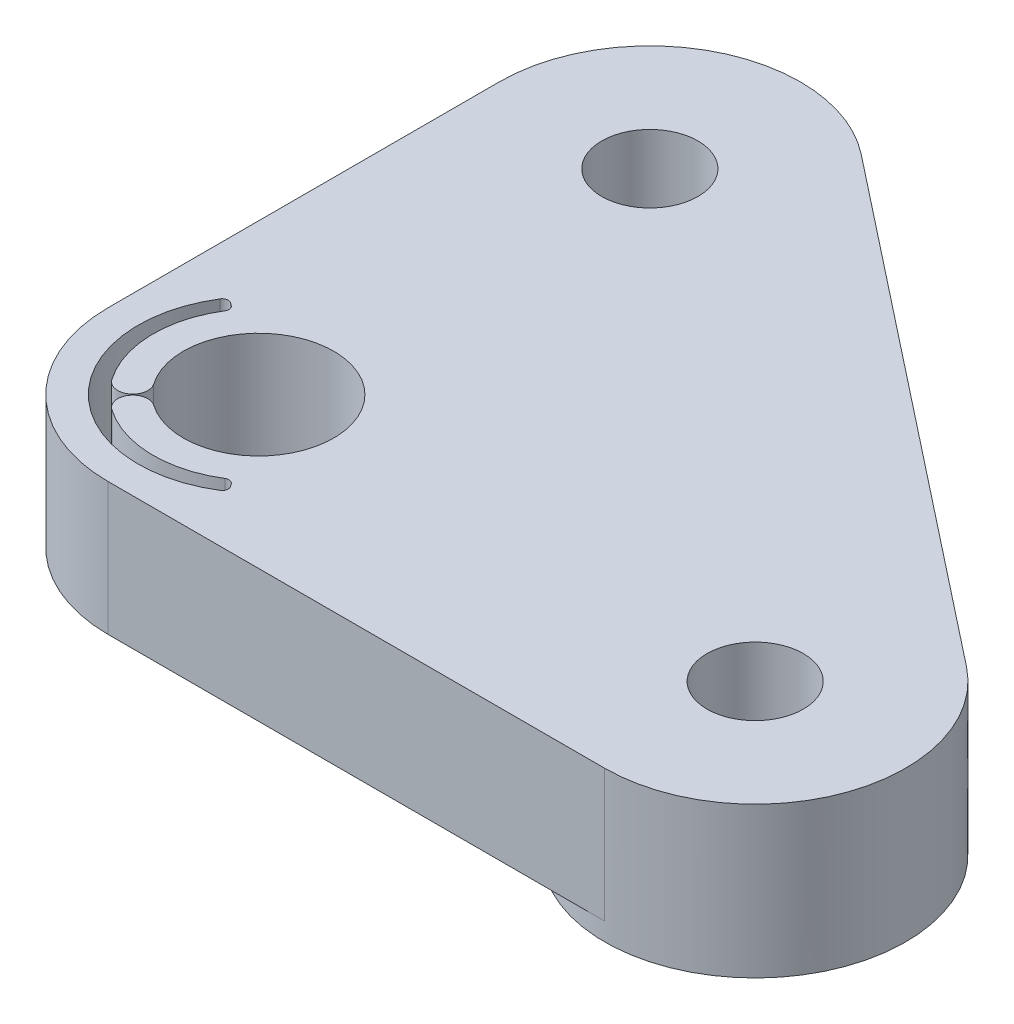
from build123d import *
from build123d.topology import SkipClean

# Parameters (mm, degrees)
SKETCH1_R           = 1.6
SKETCH1_R_2         = 2.5
BOSS_EXTRUDE1_DEPTH = 1.57
FILLET1_R           = 5
SKETCH2_R           = 2.5
SKETCH2_R_2         = 1.6
BOSS_EXTRUDE2_DEPTH = 2.83
SKETCH3_R           = 5
SKETCH3_R_2         = 1.6
BOSS_EXTRUDE3_DEPTH = 0.6
CUT_EXTRUDE1_START  = -10
CUT_EXTRUDE1_DEPTH  = 10
SKETCH5_W           = 1.221153846
SKETCH5_H           = 0.325641026
PART_NUM_LEFT_DEPTH = 0.4


with BuildPart() as part:
    # Sketch1 → Boss-Extrude1 (new body)
    with BuildSketch(Plane(origin=(0, 0, 0), x_dir=(1, 0, 0), z_dir=(0, 1, 0))):
        Polygon((-5, -5), (30.925365976, -5), (-5, 23.304833799), align=None)
        with Locations((16.5, 0)):
            Circle(SKETCH1_R, mode=Mode.SUBTRACT)
        Circle(SKETCH1_R_2, mode=Mode.SUBTRACT)
        with Locations((0, 13)):
            Circle(SKETCH1_R, mode=Mode.SUBTRACT)
    extrude(amount=BOSS_EXTRUDE1_DEPTH)

    # Fillet1
    fillet1_edges = [part.edges().sort_by_distance(p)[0] for p in [
        (-5, 0.785, -23.304833799),
        (-5, 0.785, 5),
        (30.925365976, 0.785, 5),
    ]]
    fillet(fillet1_edges, radius=FILLET1_R)

    # Sketch2 → Boss-Extrude2 (add)
    with BuildSketch(Plane(origin=(0, 1.57, 0), x_dir=(1, 0, 0), z_dir=(0, 1, 0))):
        with BuildLine():
            Line((19.594361133, 3.927458361), (3.094361133, 16.927458361))
            ThreePointArc((3.094361133, 16.927458361), (-2.182681188, 17.498433375), (-5, 13))
            Line((-5, 13), (-5, 0))
            ThreePointArc((-5, 0), (-3.535533906, -3.535533906), (0, -5))
            Line((0, -5), (16.5, -5))
            ThreePointArc((16.5, -5), (21.224261413, -1.637484075), (19.594361133, 3.927458361))
        make_face()
        Circle(SKETCH2_R, mode=Mode.SUBTRACT)
        with Locations((16.5, 0)):
            Circle(SKETCH2_R_2, mode=Mode.SUBTRACT)
        with Locations((0, 13)):
            Circle(SKETCH2_R_2, mode=Mode.SUBTRACT)
    extrude(amount=BOSS_EXTRUDE2_DEPTH)

    # Sketch3 → Boss-Extrude3 (add)
    # profile 1 of 2: a face of its own
    with SkipClean():  # the faces are left unmerged after this step: merging them gives an invalid solid
        with BuildSketch(Plane.XZ):
            with Locations((16.5, 0)):
                Circle(SKETCH3_R)
            with Locations((16.5, 0)):
                Circle(SKETCH3_R_2, mode=Mode.SUBTRACT)
        # profile 2 of 2: a face of its own
        with BuildSketch(Plane.XZ):
            with Locations((0, -13)):
                Circle(SKETCH3_R)
            with Locations((0, -13)):
                Circle(SKETCH3_R_2, mode=Mode.SUBTRACT)
        extrude(amount=BOSS_EXTRUDE3_DEPTH)
    add(part.part.scale(1), mode=Mode.REPLACE)  # the faces are merged on a copy

    # Sketch4 → Cut-Extrude1 (cut)
    with BuildSketch(Plane(origin=(0, 4.4, 0), x_dir=(1, 0, 0), z_dir=(0, 1, 0)).offset(CUT_EXTRUDE1_START)):
        with BuildLine():
            Line((2.119130133, -3.026431476), (2.176569541, -3.108463452))
            ThreePointArc((2.176569541, -3.108463452), (2.208718169, -3.263081334), (2.118672771, -3.392819725))
            ThreePointArc((2.118672771, -3.392819725), (-2.828427125, -2.828427125), (-3.392819725, 2.118672771))
            ThreePointArc((-3.392819725, 2.118672771), (-3.263081334, 2.208718169), (-3.108463452, 2.176569541))
            Line((-3.108463452, 2.176569541), (-3.026431476, 2.119130133))
            ThreePointArc((-3.026431476, 2.119130133), (-2.945196197, 1.995341896), (-2.971355046, 1.849607847))
            ThreePointArc((-2.971355046, 1.849607847), (-3.498720526, -0.094629188), (-2.867032155, -2.007517527))
            ThreePointArc((-2.867032155, -2.007517527), (-2.170667915, -2.130305331), (-2.047880111, -1.433941091))
            ThreePointArc((-2.047880111, -1.433941091), (-1.767766953, -1.767766953), (-1.433941091, -2.047880111))
            ThreePointArc((-1.433941091, -2.047880111), (-2.130305331, -2.170667915), (-2.007517527, -2.867032155))
            ThreePointArc((-2.007517527, -2.867032155), (-0.094629188, -3.498720526), (1.849607847, -2.971355046))
            ThreePointArc((1.849607847, -2.971355046), (1.995341896, -2.945196197), (2.119130133, -3.026431476))
        make_face()
    extrude(amount=CUT_EXTRUDE1_DEPTH, mode=Mode.SUBTRACT)

    # Sketch5 → Part Num Left (cut)
    # profile 1 of 6: a face of its own
    with BuildSketch(Plane(origin=(9.413907875, 0, -11.948421534), x_dir=(-0.7854916722275357, 0, -0.6188722266035127), z_dir=(0.6188722266035127, 0, -0.7854916722275357))):
        Polygon((-9.377508618, 3.775), (-9.09257272, 3.775), (-9.09257272, 0.925641026), (-7.871418874, 0.925641026), (-7.871418874, 0.6), (-9.377508618, 0.6), align=None)
    # profile 2 of 6: a face of its own
    with BuildSketch(Plane(origin=(9.413907875, 0, -11.948421534), x_dir=(-0.7854916722275357, 0, -0.6188722266035127), z_dir=(0.6188722266035127, 0, -0.7854916722275357))):
        with BuildLine():
            Line((-4.411482977, 3.192407853), (-4.660801887, 3.001602564))
            add(Edge.make_bspline(
                [(-4.660801887, 3.001602564), (-4.678587229, 3.022798837), (-4.713918127, 3.06490561), (-4.770758975, 3.124032768), (-4.829996894, 3.179427684), (-4.891609239, 3.231354246), (-4.956705012, 3.277996598), (-5.023707308, 3.321785384), (-5.093736963, 3.361035404), (-5.190576037, 3.408626827), (-5.317256585, 3.45828941), (-5.476727618, 3.499930199), (-5.6431984, 3.52643798), (-5.756770508, 3.529308943), (-5.814537865, 3.530769231)],
                knots=[0, 0, 0, 0, 0.757959112, 1.505699292, 2.245454638, 2.979532153, 3.711538275, 4.438200793, 5.171680507, 5.909471876, 7.393775596, 8.890124382, 10.418191784, 12, 12, 12, 12], degree=3))
            add(Edge.make_bspline(
                [(-5.814537865, 3.530769231), (-5.846363429, 3.530402779), (-5.909719187, 3.529673277), (-6.003743159, 3.520049285), (-6.096011427, 3.506522687), (-6.186463971, 3.486451858), (-6.274985655, 3.461076696), (-6.362155191, 3.430755071), (-6.446710521, 3.393240323), (-6.529821351, 3.351776402), (-6.609449636, 3.304942934), (-6.684792429, 3.253858679), (-6.755574943, 3.199095284), (-6.821853169, 3.140447495), (-6.883694865, 3.078179431), (-6.940651926, 3.011627492), (-6.992527262, 2.941004449), (-7.040349135, 2.867241573), (-7.083177829, 2.790553719), (-7.119037077, 2.710657048), (-7.150791723, 2.628919754), (-7.175918893, 2.544418344), (-7.195807562, 2.457747406), (-7.209530514, 2.368674334), (-7.219045056, 2.277385211), (-7.21977093, 2.21550962), (-7.220136823, 2.184319912)],
                knots=[0, 0, 0, 0, 1.054917814, 2.100044995, 3.131103042, 4.146048494, 5.169673617, 6.183595914, 7.203665975, 8.234915748, 9.262203917, 10.264457458, 11.251630812, 12.227803204, 13.197192746, 14.159520551, 15.12972552, 16.100847026, 17.073214652, 18.039054194, 19.002613845, 19.979014051, 20.95965708, 21.949030935, 22.966165397, 24, 24, 24, 24], degree=3))
            add(Edge.make_bspline(
                [(-7.220136823, 2.184319912), (-7.218992173, 2.137392215), (-7.216744804, 2.045255905), (-7.196743815, 1.910299709), (-7.166349911, 1.781013097), (-7.120797209, 1.658204241), (-7.064627785, 1.540358801), (-6.993652373, 1.429470699), (-6.911450228, 1.323864244), (-6.816858434, 1.226035284), (-6.713076015, 1.136669262), (-6.601726123, 1.057974091), (-6.483086091, 0.992374162), (-6.358465862, 0.937785982), (-6.226906459, 0.895824522), (-6.08864446, 0.86628421), (-5.943980578, 0.847014518), (-5.845129765, 0.845169672), (-5.794821318, 0.844230769)],
                knots=[0, 0, 0, 0, 1.029171465, 2.020641659, 2.987623507, 3.938342917, 4.889210282, 5.84687017, 6.821220943, 7.821438502, 8.827599549, 9.822697543, 10.807740252, 11.797342354, 12.80366471, 13.83203677, 14.896651826, 16, 16, 16, 16], degree=3))
            add(Edge.make_bspline(
                [(-5.794821318, 0.844230769), (-5.73939245, 0.845762734), (-5.630295179, 0.848778006), (-5.470304183, 0.874322468), (-5.317146024, 0.915740722), (-5.170812464, 0.973705266), (-5.031716035, 1.049057348), (-4.899639064, 1.140404709), (-4.774470068, 1.248616268), (-4.699203262, 1.331241677), (-4.660801887, 1.373397436)],
                knots=[0, 0, 0, 0, 1.028121516, 2.023589091, 2.998037872, 3.967518031, 4.937445131, 5.927275754, 6.942489185, 8, 8, 8, 8], degree=3))
            Line((-4.660801887, 1.373397436), (-4.411482977, 1.1845002))
            add(Edge.make_bspline(
                [(-4.411482977, 1.1845002), (-4.431547262, 1.158611748), (-4.471579726, 1.106958846), (-4.536402356, 1.034140938), (-4.604689619, 0.965647992), (-4.676948727, 0.902032221), (-4.752348438, 0.84202067), (-4.832242607, 0.787318294), (-4.915580944, 0.737161564), (-5.002081078, 0.691235711), (-5.091651105, 0.650489351), (-5.1841837, 0.61560629), (-5.279280008, 0.585557283), (-5.376944376, 0.560835883), (-5.477379384, 0.541539972), (-5.5802226, 0.528640695), (-5.685695987, 0.519803387), (-5.756853561, 0.518997921), (-5.792913265, 0.518589744)],
                knots=[0, 0, 0, 0, 0.986787822, 1.968848986, 2.935600012, 3.899624008, 4.868462664, 5.837806735, 6.815139263, 7.798259679, 8.787526145, 9.778297419, 10.776456485, 11.791383307, 12.812564526, 13.85620153, 14.913611965, 16, 16, 16, 16], degree=3))
            add(Edge.make_bspline(
                [(-5.792913265, 0.518589744), (-5.827061449, 0.518827408), (-5.894585254, 0.519297361), (-5.994279121, 0.526910255), (-6.091333955, 0.537296803), (-6.185472366, 0.552936064), (-6.277208072, 0.571391287), (-6.365709459, 0.596130213), (-6.4518474, 0.623842671), (-6.535275823, 0.656413623), (-6.616065694, 0.693167589), (-6.693956437, 0.734707074), (-6.768912229, 0.780682766), (-6.841670004, 0.83008124), (-6.911154955, 0.884489221), (-6.977969224, 0.943151096), (-7.04248747, 1.005869149), (-7.082404192, 1.051094623), (-7.102473562, 1.073833133)],
                knots=[0, 0, 0, 0, 1.114604814, 2.203992996, 3.262667896, 4.300477797, 5.318619304, 6.316056647, 7.298880507, 8.271930387, 9.238335007, 10.195173496, 11.151986948, 12.108099108, 13.064862484, 14.031167946, 15.010108607, 16, 16, 16, 16], degree=3))
            add(Edge.make_bspline(
                [(-7.102473562, 1.073833133), (-7.134618753, 1.113331212), (-7.198521049, 1.191850513), (-7.28027792, 1.319109939), (-7.350261773, 1.451977528), (-7.406845644, 1.591151321), (-7.451080409, 1.736319022), (-7.481724779, 1.88755381), (-7.50163802, 2.044714444), (-7.503915211, 2.151609245), (-7.50507272, 2.205944511)],
                knots=[0, 0, 0, 0, 0.994628077, 1.977248131, 2.950237994, 3.925870899, 4.908910175, 5.911660606, 6.938484602, 8, 8, 8, 8], degree=3))
            add(Edge.make_bspline(
                [(-7.50507272, 2.205944511), (-7.503661938, 2.263054101), (-7.500886311, 2.375413654), (-7.477304411, 2.540308598), (-7.439368788, 2.698288795), (-7.385487325, 2.849059335), (-7.317174614, 2.993413232), (-7.232786185, 3.130247753), (-7.133302421, 3.260437993), (-7.019503556, 3.382008518), (-6.89471033, 3.493169216), (-6.76107112, 3.590964844), (-6.618847497, 3.672351447), (-6.469606303, 3.74038368), (-6.312230006, 3.792675443), (-6.147054378, 3.829281549), (-5.974389791, 3.852066361), (-5.856586019, 3.854946728), (-5.796729371, 3.856410256)],
                knots=[0, 0, 0, 0, 1.032925535, 2.032216505, 3.007276963, 3.968222605, 4.92396291, 5.891752235, 6.871517503, 7.883894988, 8.900124299, 9.891468569, 10.874487609, 11.85992873, 12.854644235, 13.869047385, 14.917252991, 16, 16, 16, 16], degree=3))
            add(Edge.make_bspline(
                [(-5.796729371, 3.856410256), (-5.7602491, 3.855972888), (-5.688040078, 3.855107162), (-5.5812216, 3.846665162), (-5.477224632, 3.832592104), (-5.375977527, 3.813436813), (-5.276987725, 3.789663028), (-5.181011792, 3.7586929), (-5.087486555, 3.72328119), (-4.99700186, 3.682497439), (-4.909991846, 3.636716895), (-4.826483614, 3.586447007), (-4.747140493, 3.531750098), (-4.67140418, 3.47309136), (-4.600541617, 3.40922981), (-4.532540847, 3.341921991), (-4.469711155, 3.269229165), (-4.4309279, 3.218061832), (-4.411482977, 3.192407853)],
                knots=[0, 0, 0, 0, 1.096760587, 2.17092713, 3.219439832, 4.250915756, 5.268269357, 6.278326846, 7.281116186, 8.274029601, 9.260640565, 10.235837813, 11.203064059, 12.156899882, 13.114053108, 14.069676657, 15.032185724, 16, 16, 16, 16], degree=3))
        make_face()
    # profile 3 of 6: a face of its own
    with BuildSketch(Plane(origin=(9.413907875, 0, -11.948421534), x_dir=(-0.7854916722275357, 0, -0.6188722266035127), z_dir=(0.6188722266035127, 0, -0.7854916722275357))):
        with BuildLine():
            Line((-3.760200926, 3.775), (-3.124819315, 3.775))
            add(Edge.make_bspline(
                [(-3.124819315, 3.775), (-3.082418434, 3.774858861), (-3.001004046, 3.774587859), (-2.884369722, 3.773076774), (-2.778390856, 3.768745752), (-2.683122858, 3.76501868), (-2.598567479, 3.758222418), (-2.524465436, 3.751726689), (-2.461158025, 3.743223439), (-2.422835003, 3.735326377), (-2.405483377, 3.731750801)],
                knots=[0, 0, 0, 0, 1.410062039, 2.707475311, 3.878576406, 4.937260626, 5.877586885, 6.699081471, 7.410979367, 8, 8, 8, 8], degree=3))
            add(Edge.make_bspline(
                [(-2.405483377, 3.731750801), (-2.382254511, 3.726011521), (-2.336292314, 3.714655396), (-2.270116182, 3.690652758), (-2.20705676, 3.662876384), (-2.147375991, 3.630252152), (-2.091372809, 3.592537888), (-2.03846977, 3.550384662), (-1.988426814, 3.504023126), (-1.943267763, 3.452284377), (-1.900687338, 3.398004114), (-1.864774798, 3.339308563), (-1.833817206, 3.277929892), (-1.809169665, 3.213243877), (-1.789323218, 3.145877841), (-1.775329415, 3.075221576), (-1.766937266, 3.001596977), (-1.766082869, 2.951379445), (-1.765649643, 2.925916466)],
                knots=[0, 0, 0, 0, 1.027469482, 2.033020251, 3.019912614, 3.986113645, 4.951240523, 5.91722682, 6.890402269, 7.87763091, 8.8651537, 9.85103654, 10.82876324, 11.815024772, 12.821070561, 13.842952187, 14.906261191, 16, 16, 16, 16], degree=3))
            add(Edge.make_bspline(
                [(-1.765649643, 2.925916466), (-1.766982235, 2.883611764), (-1.769582465, 2.801064333), (-1.793825952, 2.681266248), (-1.833537509, 2.569515941), (-1.88825935, 2.46595412), (-1.957945589, 2.372599463), (-2.041697363, 2.290602407), (-2.139561397, 2.221986201), (-2.230665133, 2.174404013), (-2.311141586, 2.143930446), (-2.377393234, 2.122488892), (-2.449662563, 2.105922681), (-2.527257146, 2.091081704), (-2.61049989, 2.079876953), (-2.699191283, 2.071670399), (-2.793394578, 2.066541369), (-2.858109305, 2.065777551), (-2.891400845, 2.065384615)],
                knots=[0, 0, 0, 0, 1.260483769, 2.459530307, 3.627416485, 4.787058657, 5.939039949, 7.08810263, 8.267026773, 9.491475466, 10.141966685, 10.831826277, 11.566392101, 12.351337768, 13.187381173, 14.07005841, 15.007169909, 16, 16, 16, 16], degree=3))
            Line((-2.891400845, 2.065384615), (-1.724944515, 0.6))
            Line((-1.724944515, 0.6), (-2.077298281, 0.6))
            Line((-2.077298281, 0.6), (-3.243754611, 2.065384615))
            Line((-3.243754611, 2.065384615), (-3.475265028, 2.065384615))
            Line((-3.475265028, 2.065384615), (-3.475265028, 0.6))
            Line((-3.475265028, 0.6), (-3.760200926, 0.6))
            Line((-3.760200926, 0.6), (-3.760200926, 3.775))
        make_face()
        with BuildLine():
            Line((-3.475265028, 3.449358974), (-3.475265028, 2.391025641))
            Line((-3.475265028, 2.391025641), (-2.893944916, 2.386573518))
            add(Edge.make_bspline(
                [(-2.893944916, 2.386573518), (-2.866803166, 2.38656151), (-2.814194725, 2.386538236), (-2.738084836, 2.390161162), (-2.667218735, 2.3942826), (-2.601867481, 2.40058665), (-2.542001881, 2.408711086), (-2.487651856, 2.418873793), (-2.438728688, 2.430713879), (-2.381670728, 2.449039639), (-2.31795616, 2.47807367), (-2.248712621, 2.520315229), (-2.189746215, 2.573445788), (-2.139927868, 2.63420028), (-2.09989617, 2.700998877), (-2.071673092, 2.773040869), (-2.053763876, 2.848507533), (-2.051651553, 2.900376245), (-2.050585541, 2.926552484)],
                knots=[0, 0, 0, 0, 1.146690395, 2.22261258, 3.21895312, 4.145990853, 4.996080663, 5.770904154, 6.481378293, 7.121626537, 8.300444488, 9.431385265, 10.535395872, 11.636531494, 12.74115979, 13.810798291, 14.895190096, 16, 16, 16, 16], degree=3))
            add(Edge.make_bspline(
                [(-2.050585541, 2.926552484), (-2.051676036, 2.952085447), (-2.053837001, 3.002682464), (-2.071479812, 3.07675604), (-2.10131518, 3.146666773), (-2.141521781, 3.21213027), (-2.190506729, 3.27155333), (-2.24794503, 3.322396105), (-2.312266172, 3.364350976), (-2.372383616, 3.391161022), (-2.426117509, 3.407598317), (-2.472771557, 3.419165444), (-2.525486969, 3.428458641), (-2.584519707, 3.435904525), (-2.649617758, 3.442304367), (-2.721110277, 3.446614909), (-2.798522927, 3.449167486), (-2.852177644, 3.449293659), (-2.879952528, 3.449358974)],
                knots=[0, 0, 0, 0, 1.101028733, 2.181837193, 3.264309656, 4.369019818, 5.486613113, 6.575447106, 7.666700264, 8.788928104, 9.402425223, 10.0903467, 10.862060571, 11.710948788, 12.657782767, 13.684531032, 14.801375019, 16, 16, 16, 16], degree=3))
            Line((-2.879952528, 3.449358974), (-3.475265028, 3.449358974))
        make_face(mode=Mode.SUBTRACT)
    # profile 4 of 6: a face of its own
    with BuildSketch(Plane(origin=(9.413907875, 0, -11.948421534), x_dir=(-0.7854916722275357, 0, -0.6188722266035127), z_dir=(0.6188722266035127, 0, -0.7854916722275357))):
        with Locations((-0.748021438, 1.821153846)):
            Rectangle(SKETCH5_W, SKETCH5_H)
    # profile 5 of 6: a face of its own
    with BuildSketch(Plane(origin=(9.413907875, 0, -11.948421534), x_dir=(-0.7854916722275357, 0, -0.6188722266035127), z_dir=(0.6188722266035127, 0, -0.7854916722275357))):
        with BuildLine():
            add(Edge.make_bspline(
                [(0.106786254, 2.186227965), (0.107083813, 2.237116309), (0.107661827, 2.335967652), (0.114092037, 2.480008006), (0.124773955, 2.615136268), (0.139412857, 2.741358907), (0.157227311, 2.858708507), (0.181008502, 2.966871466), (0.208052973, 3.066348394), (0.239396977, 3.157463681), (0.274764472, 3.241444883), (0.313258408, 3.319844887), (0.356406472, 3.392545069), (0.401742671, 3.460705779), (0.451102194, 3.523211273), (0.503080382, 3.58094426), (0.559705941, 3.632570441), (0.619053956, 3.679602444), (0.681661749, 3.720831607), (0.745744739, 3.75714702), (0.811744013, 3.788171185), (0.879839765, 3.812564652), (0.949419942, 3.832713063), (1.020727781, 3.846491609), (1.093881019, 3.85516109), (1.143258106, 3.855989917), (1.168299675, 3.856410256)],
                knots=[0, 0, 0, 0, 1.646270934, 3.197905019, 4.663502075, 6.030701355, 7.308322542, 8.50163776, 9.611534131, 10.641858119, 11.616356847, 12.558055219, 13.465016945, 14.349605745, 15.204443733, 16.039544428, 16.859896111, 17.680448484, 18.487036065, 19.28249412, 20.06191084, 20.843045899, 21.620316918, 22.403196591, 23.190181807, 24, 24, 24, 24], degree=3))
            add(Edge.make_bspline(
                [(1.168299675, 3.856410256), (1.193550431, 3.855967738), (1.243766239, 3.855087709), (1.318007151, 3.846629561), (1.390532934, 3.832595043), (1.461034388, 3.812709587), (1.530090626, 3.788039223), (1.59716151, 3.757117338), (1.662663648, 3.721122937), (1.725556123, 3.67882842), (1.786529381, 3.631673069), (1.844085748, 3.578366934), (1.898230461, 3.51944826), (1.94964306, 3.455547427), (1.996864923, 3.385438814), (2.041835108, 3.3103418), (2.082086883, 3.228943087), (2.120853339, 3.142600805), (2.154315105, 3.048925915), (2.184492342, 2.948446454), (2.208875406, 2.839975584), (2.229185675, 2.724082419), (2.244919973, 2.600341345), (2.256379584, 2.469017616), (2.262433026, 2.330024833), (2.263573033, 2.234994498), (2.264158049, 2.186227965)],
                knots=[0, 0, 0, 0, 0.810914788, 1.612654377, 2.396697861, 3.181598691, 3.963628158, 4.749916497, 5.551656086, 6.361998678, 7.18212741, 8.025565596, 8.878627764, 9.750805457, 10.657531673, 11.591944965, 12.560506719, 13.57287815, 14.630710178, 15.753379473, 16.941251878, 18.199788006, 19.531962791, 20.947069417, 22.433333509, 24, 24, 24, 24], degree=3))
            add(Edge.make_bspline(
                [(2.264158049, 2.186227965), (2.263566969, 2.137674134), (2.262415273, 2.043068975), (2.256447446, 1.90470159), (2.244692116, 1.774074794), (2.229987341, 1.650875303), (2.20962111, 1.535615891), (2.184579281, 1.427897713), (2.15677506, 1.327255591), (2.122453496, 1.234514012), (2.084888066, 1.148379235), (2.044016567, 1.067945464), (2.000228939, 0.992501756), (1.952523435, 0.922651986), (1.901674981, 0.857901347), (1.846595273, 0.799392789), (1.788836956, 0.745716537), (1.727684265, 0.697953989), (1.663810929, 0.656148487), (1.598533766, 0.618761637), (1.530694554, 0.588614835), (1.461830661, 0.562729477), (1.390957072, 0.542953353), (1.318162132, 0.529279212), (1.243816118, 0.519689035), (1.193558984, 0.518957443), (1.168299675, 0.518589744)],
                knots=[0, 0, 0, 0, 1.561518951, 3.042555995, 4.452378317, 5.7783523, 7.031515105, 8.214008947, 9.334062868, 10.386615937, 11.391082383, 12.354592575, 13.286541444, 14.194233754, 15.072674879, 15.931287219, 16.775624067, 17.606195743, 18.42308326, 19.229000347, 20.022332153, 20.807536673, 21.593273796, 22.3848459, 23.188221202, 24, 24, 24, 24], degree=3))
            add(Edge.make_bspline(
                [(1.168299675, 0.518589744), (1.143258801, 0.519012795), (1.093883083, 0.519846969), (1.020719811, 0.528477282), (0.949706452, 0.542352489), (0.880492582, 0.561780408), (0.812723101, 0.58556101), (0.747321469, 0.61654328), (0.683560499, 0.652224899), (0.621610302, 0.692860746), (0.562634984, 0.739416844), (0.506302678, 0.790910163), (0.454028554, 0.848625686), (0.405374767, 0.911652088), (0.359133987, 0.979409529), (0.316598627, 1.052823125), (0.277255066, 1.131601779), (0.241292757, 1.216254455), (0.209407898, 1.308016425), (0.181243191, 1.407937466), (0.159005348, 1.516899507), (0.13997081, 1.634027404), (0.124617977, 1.75982447), (0.114136554, 1.894358997), (0.107658361, 2.037547151), (0.107082261, 2.135763303), (0.106786254, 2.186227965)],
                knots=[0, 0, 0, 0, 0.810891512, 1.598919785, 2.382837074, 3.152667961, 3.926044502, 4.706494248, 5.493654104, 6.291793342, 7.103789334, 7.925228297, 8.761435821, 9.622817696, 10.50288917, 11.416980706, 12.369136599, 13.353924996, 14.394355917, 15.514179734, 16.714354668, 17.994756427, 19.357759367, 20.818452758, 22.365282078, 24, 24, 24, 24], degree=3))
        make_face()
        with BuildLine():
            add(Edge.make_bspline(
                [(0.391722151, 2.1875), (0.391830507, 2.145092252), (0.392040804, 2.06278714), (0.397534643, 1.943186467), (0.405018782, 1.831634812), (0.414671959, 1.727990532), (0.429007491, 1.63260445), (0.445070077, 1.544820523), (0.464617272, 1.465103315), (0.487744896, 1.392905801), (0.514087505, 1.327002717), (0.542849253, 1.265678758), (0.573747194, 1.208209501), (0.608326709, 1.155111156), (0.645986802, 1.106210565), (0.68587683, 1.06064221), (0.729485532, 1.020004948), (0.789813927, 0.971267015), (0.869457871, 0.92090323), (0.969806427, 0.87704642), (1.072919951, 0.849485191), (1.142907156, 0.845980213), (1.17783994, 0.844230769)],
                knots=[0, 0, 0, 0, 1.459021318, 2.831673884, 4.118529203, 5.306027144, 6.411944654, 7.436330062, 8.375795394, 9.233974572, 10.042671642, 10.816086306, 11.563610507, 12.285937304, 12.993564865, 13.685989202, 14.367179055, 15.041617293, 16.353048772, 17.594441528, 18.799311195, 20, 20, 20, 20], degree=3))
            add(Edge.make_bspline(
                [(1.17783994, 0.844230769), (1.212998685, 0.845680185), (1.283243585, 0.848576023), (1.385872099, 0.876514878), (1.485503844, 0.918669388), (1.56358339, 0.968514626), (1.622985412, 1.015983896), (1.665545824, 1.056455755), (1.704609254, 1.101772864), (1.74165885, 1.150667225), (1.775639583, 1.204072978), (1.806539715, 1.261733315), (1.834736752, 1.323808354), (1.850801387, 1.367142332), (1.85901482, 1.389297877)],
                knots=[0, 0, 0, 0, 1.353760809, 2.704726607, 4.075137775, 5.516104923, 6.260822281, 7.007110065, 7.778089737, 8.566572457, 9.372053459, 10.217411131, 11.088608312, 12, 12, 12, 12], degree=3))
            add(Edge.make_bspline(
                [(1.85901482, 1.389297877), (1.86858678, 1.417627712), (1.888021966, 1.475149426), (1.91306979, 1.564379311), (1.932795973, 1.657998961), (1.950542741, 1.755448888), (1.96265587, 1.85744776), (1.972405672, 1.96367998), (1.978148509, 2.074225644), (1.978860391, 2.149332529), (1.979222151, 2.1875)],
                knots=[0, 0, 0, 0, 0.884706709, 1.796334032, 2.740027952, 3.714592787, 4.726048262, 5.777819803, 6.87074269, 8, 8, 8, 8], degree=3))
            add(Edge.make_bspline(
                [(1.979222151, 2.1875), (1.978723051, 2.225661298), (1.977746704, 2.300312955), (1.97401473, 2.409640161), (1.96437763, 2.513478773), (1.953674144, 2.61227613), (1.937892379, 2.705485333), (1.920876368, 2.793886682), (1.898015269, 2.876384997), (1.873595187, 2.954271903), (1.845645757, 3.026662497), (1.814879341, 3.093894289), (1.782021031, 3.156291861), (1.746331999, 3.213684015), (1.708235915, 3.266327822), (1.666727281, 3.313167775), (1.6234526, 3.355655596), (1.562839867, 3.404153784), (1.48348819, 3.453603679), (1.384749638, 3.49911119), (1.281996982, 3.525244427), (1.21253392, 3.528928957), (1.17783994, 3.530769231)],
                knots=[0, 0, 0, 0, 1.31362396, 2.569729283, 3.763502607, 4.902122613, 5.988968491, 7.01645872, 7.998833611, 8.933434873, 9.825090667, 10.667526885, 11.477055099, 12.250526234, 12.991942729, 13.710640831, 14.402115721, 15.076753259, 16.378508321, 17.609869233, 18.806226677, 20, 20, 20, 20], degree=3))
            add(Edge.make_bspline(
                [(1.17783994, 3.530769231), (1.142723903, 3.528926418), (1.072427856, 3.525237437), (0.968607211, 3.499208557), (0.869089692, 3.453839652), (0.789947851, 3.40399), (0.729292844, 3.356511674), (0.686582115, 3.315339677), (0.64653523, 3.270303432), (0.609643817, 3.220953123), (0.575091396, 3.167916683), (0.54335862, 3.110776875), (0.514767899, 3.049244137), (0.48838407, 2.983370657), (0.465185898, 2.911179371), (0.44605066, 2.831560356), (0.428373119, 2.744055639), (0.415858839, 2.648152943), (0.404733861, 2.544482704), (0.397584352, 2.432652565), (0.392022426, 2.312851306), (0.391824248, 2.230120641), (0.391722151, 2.1875)],
                knots=[0, 0, 0, 0, 1.207732386, 2.417664972, 3.655092373, 4.956220595, 5.625982001, 6.301752483, 6.994047911, 7.697131622, 8.419323945, 9.170223765, 9.943494443, 10.752040957, 11.610060368, 12.549350801, 13.567764191, 14.679664412, 15.874934091, 17.154273443, 18.533957287, 20, 20, 20, 20], degree=3))
        make_face(mode=Mode.SUBTRACT)
    # profile 6 of 6: a face of its own
    with BuildSketch(Plane(origin=(9.413907875, 0, -11.948421534), x_dir=(-0.7854916722275357, 0, -0.6188722266035127), z_dir=(0.6188722266035127, 0, -0.7854916722275357))):
        Polygon((3.22390865, 3.775), (3.810952921, 3.775), (3.810952921, 0.6), (3.526017023, 0.6), (3.526017023, 3.449358974), (3.037555485, 3.449358974), align=None)
    extrude(amount=-PART_NUM_LEFT_DEPTH, mode=Mode.SUBTRACT)


solid = part.part
